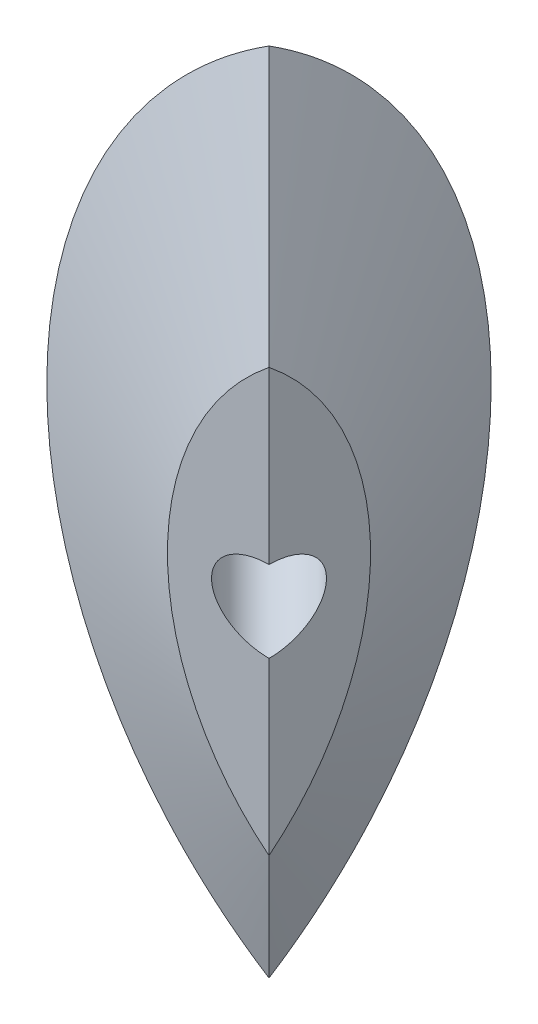
from build123d import *
from OCP.BRepAlgoAPI import BRepAlgoAPI_Cut
from OCP.TopTools import TopTools_ListOfShape

# Parameters (mm, degrees)
CUT_EXTRUDE_1_DEPTH      = 59.108987417
CUT_EXTRUDE_1_DEPTH_BACK = 59.108987417
CUT_EXTRUDE_2_DEPTH      = 59.108987417
CUT_EXTRUDE_2_DEPTH_BACK = 59.108987417
SKETCH_12_W              = 3
SKETCH_12_H              = 50.62024983


with BuildPart() as part:
    # 草图3 → 旋转1 (revolve)
    with BuildSketch(Plane(origin=(0, 0, 0), x_dir=(0, 0, -1), z_dir=(1, 0, 0))):
        with BuildLine():
            Line((0, 40), (0, -40))
            ThreePointArc((0, -40), (40, 0), (0, 40))
        make_face()
    revolve(axis=Axis((0, 40, 0), (0, -1, 0)))

    # 草图4 → 切除-旋转3 (revolve, cut)
    with BuildSketch(Plane.XY, mode=Mode.PRIVATE) as cut_revolve_3_sk:
        Polygon((-25, 50), (25, 50), (12.5, 20), (-12.5, 20), align=None)
    revolve(cut_revolve_3_sk.sketch.rotate(Axis((-55.247864245, 0, 0), (1, 0, 0)), 90), axis=Axis((-55.247864245, 0, 0), (1, 0, 0)), mode=Mode.SUBTRACT)


with BuildPart() as cut_revolve_4_tool:
    # 草图5 → 切除-旋转4 (revolve)
    with BuildSketch(Plane(origin=(0, 0, 0), x_dir=(1, 0, 0), z_dir=(0, 1, 0))):
        Polygon((-50, 25), (-50, -25), (-20, -12.5), (-20, 12.5), align=None)
    revolve(axis=Axis((0, 0, -44.002313129), (0, 0, 1)))


with BuildPart() as part_1:
    add(part.part)

    # 切除-旋转4: cut by cut_revolve_4_tool, with a tolerance
    cut_revolve_4_stock = TopTools_ListOfShape()
    cut_revolve_4_stock.Append(part_1.part.wrapped)
    cut_revolve_4_tools = TopTools_ListOfShape()
    cut_revolve_4_tools.Append(cut_revolve_4_tool.part.wrapped)
    cut_revolve_4_cut = BRepAlgoAPI_Cut()
    cut_revolve_4_cut.SetArguments(cut_revolve_4_stock)
    cut_revolve_4_cut.SetTools(cut_revolve_4_tools)
    cut_revolve_4_cut.SetFuzzyValue(0.00001)
    cut_revolve_4_cut.Build()
    add(Compound.cast(cut_revolve_4_cut.Shape()).solids(), mode=Mode.REPLACE)

    # 草图6 → 切除-拉伸1 (cut, two sides: drawn at the far end of the back side and taken through both)
    with BuildSketch(Plane(origin=(0, 0, 0), x_dir=(1, 0, 0), z_dir=(0, 1, 0)).offset(-CUT_EXTRUDE_1_DEPTH_BACK)):
        Polygon((-20, 12.5), (37.556288363, 12.5), (37.556288363, -29.25786606), (31.486585193, -38.646938151), (-34.426597666, -38.077903479), (-43.720830645, -12.186825895), align=None)
    extrude(amount=CUT_EXTRUDE_1_DEPTH + CUT_EXTRUDE_1_DEPTH_BACK, mode=Mode.SUBTRACT)

    # 草图7 → 切除-拉伸2 (cut, two sides: drawn at the far end of the back side and taken through both)
    with BuildSketch(Plane(origin=(0, 0, 0), x_dir=(1, 0, 0), z_dir=(0, 1, 0)).offset(-CUT_EXTRUDE_2_DEPTH_BACK)):
        Polygon((-12.5, 20), (-10.113298037, 50.085656358), (42.871589505, 47.227550391), (40.63466159, 5.758348279), (-0.879417221, -1.726674889), (-12.5, 12.5), align=None)
    extrude(amount=CUT_EXTRUDE_2_DEPTH + CUT_EXTRUDE_2_DEPTH_BACK, mode=Mode.SUBTRACT)

    # 草图12 → 切除-旋转7 (revolve, cut)
    with BuildSketch(Plane(origin=(0, 0, 0), x_dir=(0, 1, 0), z_dir=(0.7071067811865464, 0, -0.7071067811865488)), mode=Mode.PRIVATE) as cut_revolve_7_sk:
        with Locations((1.5, -25.310124915)):
            Rectangle(SKETCH_12_W, SKETCH_12_H)
    revolve(cut_revolve_7_sk.sketch.rotate(Axis((0, 0, 0), (-0.7071067811865488, 0, -0.7071067811865464)), 90), axis=Axis((0, 0, 0), (-0.7071067811865488, 0, -0.7071067811865464)), mode=Mode.SUBTRACT)

    # 倒角1
    # the kernel refuses this chamfer: 1, 0.93267614 mm, written as the material it takes off along each edge
    with BuildSketch(Plane(origin=(-28.204609567, 1e-09, -28.204609538), x_dir=(0.7071067811865464, -3.5887694896846076e-10, -0.7071067811865487), z_dir=(2.537647002539835e-10, 1.0, -2.537639482002908e-10))) as chamfer_1_piece_1:
        with BuildLine():
            Line((3.984104251, -0.086249492), (2.999999979, -0.932676176))
            Line((2.999999979, -0.932676176), (3.000000021, 0))
            ThreePointArc((3.000000021, 0), (3.506227368, -0.041308053), (3.984104251, -0.086249492))
        make_face()
    revolve(axis=Axis((-28.204609567, 1e-09, -28.204609538), (-0.7071067811865486, 0, -0.7071067811865465)), mode=Mode.SUBTRACT)


solid = part_1.part
